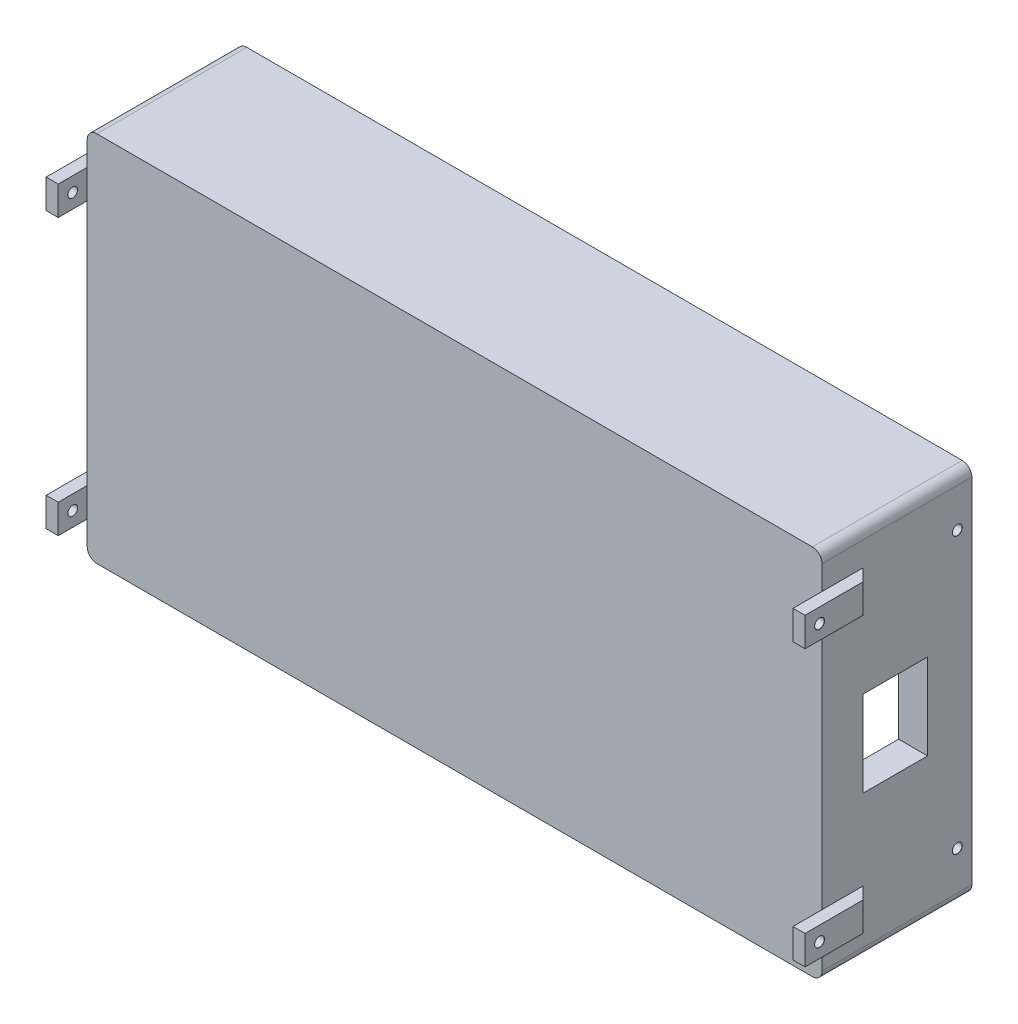
from build123d import *

# Parameters (mm, degrees)
IZIM1_W                     = 140
IZIM1_H                     = 65
Y_KSEKLIK_EKSTR_ZYON1_DEPTH = 25
BO_ALTMA3_T                 = 6
IZIM2_R                     = 2.25
KES_EKSTR_ZYON1_DEPTH       = 25
IZIM3_W                     = 13.33242511
IZIM3_H                     = 17.74072696
KES_EKSTR_ZYON2_DEPTH       = 25
RADYUS1_R                   = 2
IZIM2_2_R                   = 2.25
Y_KSEKLIK_EKSTR_ZYON2_DEPTH = 56
IZIM4_W                     = 373.647540747
IZIM4_H                     = 192.392001967
KES_EKSTR_ZYON3_DEPTH       = 1
IZIM5_R                     = 2.25
KES_EKSTR_ZYON4_DEPTH       = 25
IZIM6_W                     = 175.161164464
IZIM6_H                     = 86.760539326
KES_EKSTR_ZYON5_DEPTH       = 37
IZIM7_R                     = 2.25
Y_KSEKLIK_EKSTR_ZYON3_DEPTH = 30
IZIM8_R                     = 1
KES_EKSTR_ZYON6_DEPTH       = 16
KES_EKSTR_ZYON7_START       = -16
IZIM9_R                     = 1
KES_EKSTR_ZYON7_DEPTH       = 16
M2_DI_LI_DELIK2_D           = 1.6
M2_DI_LI_DELIK2_CSINK_D     = 2.05
M2_DI_LI_DELIK2_CSINK_ANGLE = 82
M2_DI_LI_DELIK3_D           = 1.6
M2_DI_LI_DELIK3_CSINK_D     = 2.05
M2_DI_LI_DELIK3_CSINK_ANGLE = 82
IZIM16_W                    = 12
IZIM16_H                    = 6
IZIM16_R                    = 1
Y_KSEKLIK_EKSTR_ZYON4_DEPTH = 2.5
Y_KSEKLIK_EKSTR_ZYON5_START = 2.5
IZIM17_W                    = 12
IZIM17_H                    = 6
IZIM17_R                    = 1
Y_KSEKLIK_EKSTR_ZYON5_DEPTH = 2.5
PAH1_SIZE                   = 2.5


# Read off the part's stored shape, not the designer's step: M2 Dişli Delik4
with BuildPart() as part:
    # Çizim1 → Yükseklik-Ekstrüzyon1 (new body)
    with BuildSketch(Plane.XY):
        Rectangle(IZIM1_W, IZIM1_H)
    extrude(amount=Y_KSEKLIK_EKSTR_ZYON1_DEPTH)

    # İç Boşaltma3
    bo_altma3_openings = [part.faces().sort_by_distance(p)[0] for p in [
        (0, 0, 0),
    ]]
    offset(amount=BO_ALTMA3_T, openings=bo_altma3_openings, kind=Kind.INTERSECTION)

    # Çizim2 → Kes-Ekstrüzyon1 (cut)
    with BuildSketch(Plane(origin=(0, 0, 0), x_dir=(-1, 0, 0), z_dir=(0, 0, -1))):
        with Locations((-73, -35.5)):
            Circle(IZIM2_R)
        with Locations(Location((73, -35.5, 0), (0, 0, 180))):
            Circle(IZIM2_R)
        with Locations(Location((-73, 35.5, 0), (0, 0, 180))):
            Circle(IZIM2_R)
        with Locations((73, 35.5)):
            Circle(IZIM2_R)
    extrude(amount=-KES_EKSTR_ZYON1_DEPTH, mode=Mode.SUBTRACT)

    # Çizim3 → Kes-Ekstrüzyon2 (cut)
    with BuildSketch(Plane.ZY.offset(-70)):
        with Locations((15.822558672, 0)):
            Rectangle(IZIM3_W, IZIM3_H)
    extrude(amount=-KES_EKSTR_ZYON2_DEPTH, mode=Mode.SUBTRACT)

    # Radyus1
    radyus1_edges = [part.edges().sort_by_distance(p)[0] for p in [
        (76, -38.5, 15.5),
        (-76, -38.5, 15.5),
        (-76, 38.5, 15.5),
        (76, 38.5, 15.5),
    ]]
    fillet(radyus1_edges, radius=RADYUS1_R)

    # Çizim2<2> → Yükseklik-Ekstrüzyon2 (add)
    with BuildSketch(Plane(origin=(0, 0, 0), x_dir=(-1, 0, 0), z_dir=(0, 0, -1))):
        with Locations((-73, -35.5)):
            Circle(IZIM2_2_R)
        with Locations((73, -35.5)):
            Circle(IZIM2_2_R)
        with Locations((-73, 35.5)):
            Circle(IZIM2_2_R)
        with Locations((73, 35.5)):
            Circle(IZIM2_2_R)
    extrude(amount=-Y_KSEKLIK_EKSTR_ZYON2_DEPTH)

    # Çizim4 → Kes-Ekstrüzyon3 (cut)
    with BuildSketch(Plane.XY.offset(56)):
        with Locations((-92.221826013, 44.195860188)):
            Rectangle(IZIM4_W, IZIM4_H)
    extrude(amount=-KES_EKSTR_ZYON3_DEPTH, mode=Mode.SUBTRACT)

    # Çizim5 → Kes-Ekstrüzyon4 (cut)
    with BuildSketch(Plane(origin=(0, 0, 0), x_dir=(-1, 0, 0), z_dir=(0, 0, -1))):
        with Locations((-73, -35.527793561)):
            Circle(IZIM5_R)
        with Locations(Location((-73, 35.527793561, 0), (0, 0, 180))):
            Circle(IZIM5_R)
        with Locations((73, 35.527793561)):
            Circle(IZIM5_R)
        with Locations(Location((73, -35.527793561, 0), (0, 0, 180))):
            Circle(IZIM5_R)
    extrude(amount=-KES_EKSTR_ZYON4_DEPTH, mode=Mode.SUBTRACT)

    # Çizim6 → Kes-Ekstrüzyon5 (cut)
    with BuildSketch(Plane.XY.offset(31)):
        Rectangle(IZIM6_W, IZIM6_H)
    extrude(amount=KES_EKSTR_ZYON5_DEPTH, mode=Mode.SUBTRACT)

    # Çizim7 → Yükseklik-Ekstrüzyon3 (add)
    with BuildSketch(Plane(origin=(0, 0, 0), x_dir=(-1, 0, 0), z_dir=(0, 0, -1))):
        with Locations((-73, 35.527793561)):
            Circle(IZIM7_R)
        with Locations((-73, -35.527793561)):
            Circle(IZIM7_R)
        with Locations((73, -35.527793561)):
            Circle(IZIM7_R)
        with Locations((73, 35.527793561)):
            Circle(IZIM7_R)
    extrude(amount=-Y_KSEKLIK_EKSTR_ZYON3_DEPTH)

    # Çizim8 → Kes-Ekstrüzyon6 (cut)
    with BuildSketch(Plane(origin=(76, 0, 0), x_dir=(0, 0, -1), z_dir=(1, 0, 0))):
        with Locations((-3, 28.5)):
            Circle(IZIM8_R)
        with Locations(Location((-3, -28.5, 0), (0, 0, 180))):
            Circle(IZIM8_R)
    extrude(amount=-KES_EKSTR_ZYON6_DEPTH, mode=Mode.SUBTRACT)

    # Çizim9 → Kes-Ekstrüzyon7 (cut)
    with BuildSketch(Plane.ZY.offset(76).offset(KES_EKSTR_ZYON7_START)):
        with Locations(Location((3, 28.5, 0), (0, 0, 180))):
            Circle(IZIM9_R)
        with Locations((3, -28.5)):
            Circle(IZIM9_R)
    extrude(amount=KES_EKSTR_ZYON7_DEPTH, mode=Mode.SUBTRACT)

    # M2 Dişli Delik2 (through all)
    with Locations(Plane(origin=(-76, 28.5, 3), x_dir=(0, 0, -1), z_dir=(-1, 0, 0))):
        with Locations((0, 0), (0, 57)):
            CounterSinkHole(M2_DI_LI_DELIK2_D / 2, M2_DI_LI_DELIK2_CSINK_D / 2, counter_sink_angle=M2_DI_LI_DELIK2_CSINK_ANGLE)

    # M2 Dişli Delik3 (through all)
    with Locations(Plane(origin=(76, 28.5, 3), x_dir=(0, 0, 1), z_dir=(1, 0, 0))):
        with Locations((0, 0), (0, 57)):
            CounterSinkHole(M2_DI_LI_DELIK3_D / 2, M2_DI_LI_DELIK3_CSINK_D / 2, counter_sink_angle=M2_DI_LI_DELIK3_CSINK_ANGLE)

    # Çizim16 → Yükseklik-Ekstrüzyon4 (add)
    # profile 1 of 2: a face of its own
    with BuildSketch(Plane(origin=(76, 0, 0), x_dir=(0, 0, -1), z_dir=(1, 0, 0))):
        with Locations((-31, 28.5)):
            Rectangle(IZIM16_W, IZIM16_H)
        with Locations((-34, 28.5)):
            Circle(IZIM16_R, mode=Mode.SUBTRACT)
    # profile 2 of 2: a face of its own
    with BuildSketch(Plane(origin=(76, 0, 0), x_dir=(0, 0, -1), z_dir=(1, 0, 0))):
        with Locations((-31, -28.5)):
            Rectangle(IZIM16_W, IZIM16_H)
        with Locations(Location((-34, -28.5, 0), (0, 0, 180))):
            Circle(IZIM16_R, mode=Mode.SUBTRACT)
    extrude(amount=Y_KSEKLIK_EKSTR_ZYON4_DEPTH)

    # Çizim17 → Yükseklik-Ekstrüzyon5 (add)
    # profile 1 of 2: a face of its own
    with BuildSketch(Plane.ZY.offset(76).offset(Y_KSEKLIK_EKSTR_ZYON5_START)):
        with Locations((31, 28.5)):
            Rectangle(IZIM17_W, IZIM17_H)
        with Locations(Location((34, 28.5, 0), (0, 0, 180))):
            Circle(IZIM17_R, mode=Mode.SUBTRACT)
    # profile 2 of 2: a face of its own
    with BuildSketch(Plane.ZY.offset(76).offset(Y_KSEKLIK_EKSTR_ZYON5_START)):
        with Locations((31, -28.5)):
            Rectangle(IZIM17_W, IZIM17_H)
        with Locations((34, -28.5)):
            Circle(IZIM17_R, mode=Mode.SUBTRACT)
    extrude(amount=-Y_KSEKLIK_EKSTR_ZYON5_DEPTH)

    # M2 Dişli Delik4 outline → M2 Dişli Delik4 (revolve, cut)
    with BuildSketch(Plane(origin=(0, 28.5, 34), x_dir=(0, 1, 0), z_dir=(0, 0, -1))):
        Polygon((1, 78.5), (1, 78.47124079), (1.025, 78.5), align=None)
        Polygon((1.025, -78.5), (1, -78.47124079), (1, -78.5), align=None)
    revolve(axis=Axis((0, 28.5, 34), (1, 0, 0)), mode=Mode.SUBTRACT)

    # M2 Di_li Delik4 2 outline → M2 Di_li Delik4 2 (revolve, cut)
    with BuildSketch(Plane(origin=(0, -28.5, 34), x_dir=(0, 1, 0), z_dir=(0, 0, -1))):
        Polygon((1, 78.5), (1, 78.47124079), (1.025, 78.5), align=None)
        Polygon((1.025, -78.5), (1, -78.47124079), (1, -78.5), align=None)
    revolve(axis=Axis((0, -28.5, 34), (1, 0, 0)), mode=Mode.SUBTRACT)

    # Pah1
    pah1_edges = [part.edges().sort_by_distance(p)[0] for p in [
        (76, -28.5, 25),
        (76, 28.5, 25),
        (-76, 28.5, 25),
        (-76, -28.5, 25),
    ]]
    chamfer(pah1_edges, length=PAH1_SIZE - 0.0001)  # a hair under: the kernel refuses the full size


solid = part.part
